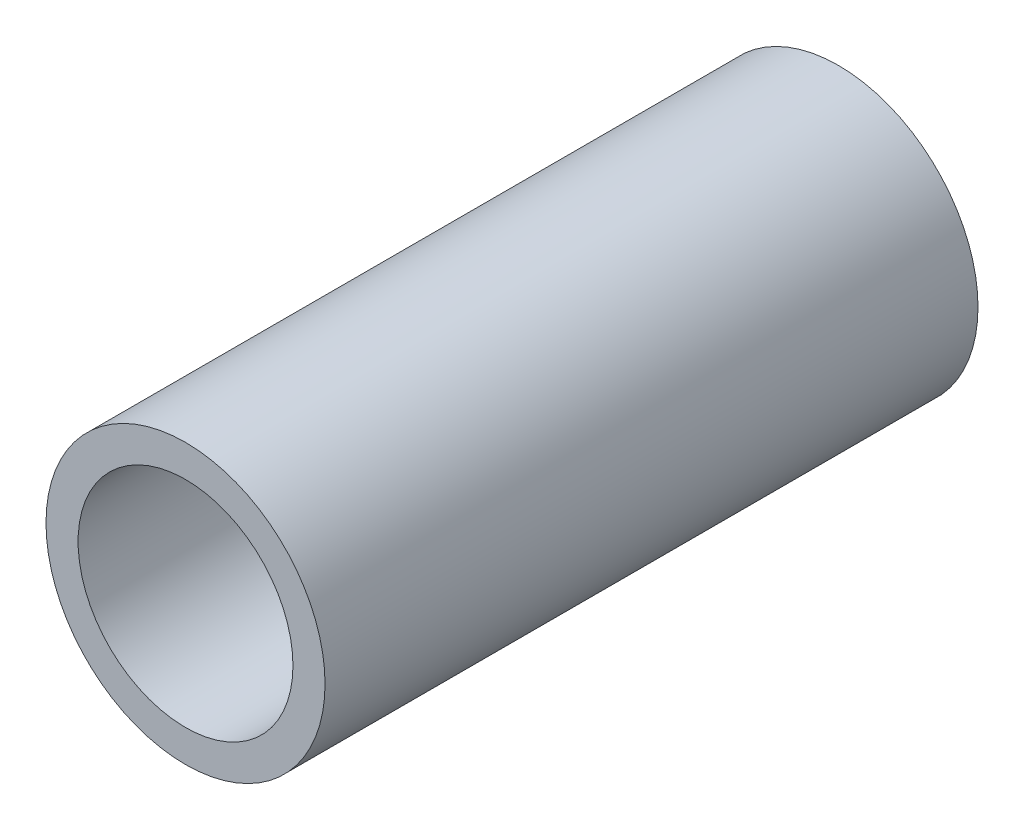
from build123d import *

# Parameters (mm, degrees)
SKETCH1_R           = 6.35
SKETCH1_R_2         = 4.8895
BOSS_EXTRUDE1_DEPTH = 29.718


with BuildPart() as part:
    # Sketch1 → Boss-Extrude1 (new body)
    with BuildSketch(Plane.XY):
        Circle(SKETCH1_R)
        Circle(SKETCH1_R_2, mode=Mode.SUBTRACT)
    extrude(amount=BOSS_EXTRUDE1_DEPTH)


solid = part.part
